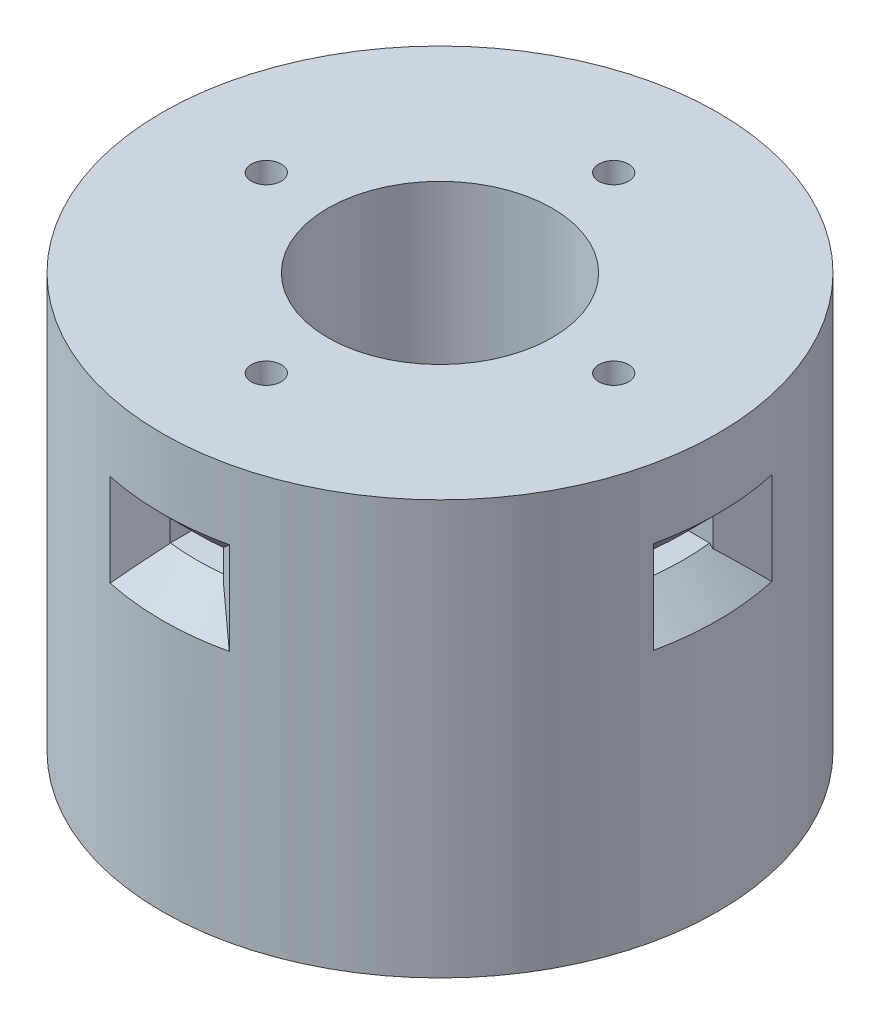
from build123d import *

# Parameters (mm, degrees)
BOSS_EXTRUDE1_DEPTH      = 10
BOSS_EXTRUDE1_DEPTH_BACK = 49.6
SKETCH1_R                = 40
CUT_EXTRUDE1_REACH       = 84.172
SKETCH2_R                = 16.15
SKETCH5_R                = 2.15
M4_HEAT_INSERT_DEPTH     = 25
SKETCH6_R                = 21.05
CUT_EXTRUDE2_DEPTH       = 16.5
CUT_EXTRUDE3_START       = -15
SKETCH7_R                = 2.15
CUT_EXTRUDE3_DEPTH       = 3.3
CIRPATTERN1_COUNT        = 4
CHAMFER1_SIZE            = 5
CHAMFER1_SIZE_2          = 4.562380824


with BuildPart() as part:
    # Sketch1 → Boss-Extrude1 (new, two sides: drawn at the far end of the back side and taken through both)
    with BuildSketch(Plane(origin=(0, 0, 0), x_dir=(1, 0, 0), z_dir=(0, 1, 0)).offset(-BOSS_EXTRUDE1_DEPTH_BACK)):
        with Locations(Location((0, 0, 0), (0, 0, 270))):
            Circle(SKETCH1_R)
    extrude(amount=BOSS_EXTRUDE1_DEPTH + BOSS_EXTRUDE1_DEPTH_BACK)

    # Sketch2 → Cut-Extrude1 (cut, up to next)
    with BuildSketch(Plane(origin=(0, 10, 0), x_dir=(1, 0, 0), z_dir=(0, 1, 0)), mode=Mode.PRIVATE) as cut_extrude1_sk1:
        with Locations(Location((0, 0, 0), (0, 0, 270))):
            Circle(SKETCH2_R)
    cut_extrude1_tool1 = extrude(cut_extrude1_sk1.sketch, amount=-CUT_EXTRUDE1_REACH, mode=Mode.PRIVATE) & part.part
    add(cut_extrude1_tool1.solids().sort_by_distance((0, 10, 0))[0], mode=Mode.SUBTRACT)

    # Sketch5 → m4 heat insert (cut)
    with BuildSketch(Plane(origin=(0, 10, 0), x_dir=(1, 0, 0), z_dir=(0, 1, 0))):
        with Locations(Location((0, 25, 0), (0, 0, 270))):
            Circle(SKETCH5_R)
        with Locations(Location((25, 0, 0), (0, 0, 270))):
            Circle(SKETCH5_R)
        with Locations(Location((0, -25, 0), (0, 0, 270))):
            Circle(SKETCH5_R)
        with Locations(Location((-25, 0, 0), (0, 0, 270))):
            Circle(SKETCH5_R)
    extrude(amount=-M4_HEAT_INSERT_DEPTH, mode=Mode.SUBTRACT)

    # Sketch6 → Cut-Extrude2 (cut)
    with BuildSketch(Plane(origin=(0, -49.6, 0), x_dir=(-1, 0, 0), z_dir=(0, -1, 0))):
        with Locations(Location((0, 0, 0), (0, 0, 90))):
            Circle(SKETCH6_R)
    extrude(amount=-CUT_EXTRUDE2_DEPTH, mode=Mode.SUBTRACT)

    # Sketch7 → Cut-Extrude3 (cut)
    # profile 1 of 2: a face of its own
    with BuildSketch(Plane(origin=(0, 10, 0), x_dir=(1, 0, 0), z_dir=(0, 1, 0)).offset(CUT_EXTRUDE3_START)):
        with BuildLine():
            Line((2.020725942, 28.5), (4.041451884, 25))
            Line((4.041451884, 25), (4.041451884, 39.795309606))
            ThreePointArc((4.041451884, 39.795309606), (0, 40), (-4.041451884, 39.795309606))
            Line((-4.041451884, 39.795309606), (-4.041451884, 25))
            Line((-4.041451884, 25), (-2.020725942, 28.5))
            Line((-2.020725942, 28.5), (2.020725942, 28.5))
        make_face()
    # profile 2 of 2: a face of its own
    with BuildSketch(Plane(origin=(0, 10, 0), x_dir=(1, 0, 0), z_dir=(0, 1, 0)).offset(CUT_EXTRUDE3_START)):
        Polygon((-2.020725942, 21.5), (2.020725942, 21.5), (4.041451884, 25), (2.020725942, 28.5), (-2.020725942, 28.5), (-4.041451884, 25), align=None)
        with Locations(Location((0, 25, 0), (0, 0, 270))):
            Circle(SKETCH7_R, mode=Mode.SUBTRACT)
    cut_extrude3 = extrude(amount=-CUT_EXTRUDE3_DEPTH, mode=Mode.SUBTRACT)

    # CirPattern1: Cut-Extrude3 ×4 about axis
    cirpattern1_axis = Axis((0, 0, 0), (0, 1, 0))
    for i in range(1, CIRPATTERN1_COUNT):
        add(cut_extrude3.rotate(cirpattern1_axis, i * 360 / CIRPATTERN1_COUNT), mode=Mode.SUBTRACT)

    # Chamfer1
    # the kernel refuses this chamfer: 5, 4.562380824 mm, written as the material it takes off along each edge
    with BuildSketch(Plane(origin=(0, -8.3, 0), x_dir=(0.4101983221335599, 0, -0.9119963467683477), z_dir=(0.9119963467683477, 0, 0.4101983221335599))) as chamfer1_piece_1_section:
        Polygon((40, -CHAMFER1_SIZE), (40 - CHAMFER1_SIZE, 0), (40, 0), align=None)
    chamfer1_piece_1 = revolve(axis=Axis((0, -8.3, 0), (0, 1, 0)), revolution_arc=48.434587391, mode=Mode.PRIVATE)
    chamfer1_piece_1 = split(chamfer1_piece_1, bisect_by=Plane(origin=(4.041451884, -8.3, 0), z_dir=(-1, 0, 0)), keep=Keep.TOP, mode=Mode.PRIVATE)
    chamfer1_piece_1 = split(chamfer1_piece_1, bisect_by=Plane(origin=(-4.041451884, -8.3, 0), z_dir=(1, 0, 0)), keep=Keep.TOP, mode=Mode.PRIVATE)
    add(chamfer1_piece_1, mode=Mode.SUBTRACT)
    with BuildSketch(Plane(origin=(0, -5, 0), x_dir=(0.4101983221335599, 0, -0.9119963467683477), z_dir=(0.9119963467683477, 0, 0.4101983221335599))) as chamfer1_piece_2_section:
        Polygon((40, CHAMFER1_SIZE), (40 - CHAMFER1_SIZE, 0), (40, 0), align=None)
    chamfer1_piece_2 = revolve(axis=Axis((0, -5, 0), (0, 1, 0)), revolution_arc=48.434587391, mode=Mode.PRIVATE)
    chamfer1_piece_2 = split(chamfer1_piece_2, bisect_by=Plane(origin=(-4.041451884, -5, 0), z_dir=(1, 0, 0)), keep=Keep.TOP, mode=Mode.PRIVATE)
    chamfer1_piece_2 = split(chamfer1_piece_2, bisect_by=Plane(origin=(4.041451884, -5, 0), z_dir=(-1, 0, 0)), keep=Keep.TOP, mode=Mode.PRIVATE)
    add(chamfer1_piece_2, mode=Mode.SUBTRACT)
    with BuildSketch(Plane(origin=(0, -8.3, 0), x_dir=(0.9119963467683476, 0, 0.4101983221335601), z_dir=(-0.4101983221335601, 0, 0.9119963467683476))) as chamfer1_piece_3_section:
        Polygon((40, -CHAMFER1_SIZE), (40 - CHAMFER1_SIZE, 0), (40, 0), align=None)
    chamfer1_piece_3 = revolve(axis=Axis((0, -8.3, 0), (0, 1, 0)), revolution_arc=48.434587391, mode=Mode.PRIVATE)
    chamfer1_piece_3 = split(chamfer1_piece_3, bisect_by=Plane(origin=(0, -8.3, 4.041451884), z_dir=(0, 0, -1)), keep=Keep.TOP, mode=Mode.PRIVATE)
    chamfer1_piece_3 = split(chamfer1_piece_3, bisect_by=Plane(origin=(0, -8.3, -4.041451884), z_dir=(0, 0, 1)), keep=Keep.TOP, mode=Mode.PRIVATE)
    add(chamfer1_piece_3, mode=Mode.SUBTRACT)
    with BuildSketch(Plane(origin=(0, -5, 0), x_dir=(0.9119963467683476, 0, 0.4101983221335601), z_dir=(-0.4101983221335601, 0, 0.9119963467683476))) as chamfer1_piece_4_section:
        Polygon((40, CHAMFER1_SIZE), (40 - CHAMFER1_SIZE, 0), (40, 0), align=None)
    chamfer1_piece_4 = revolve(axis=Axis((0, -5, 0), (0, 1, 0)), revolution_arc=48.434587391, mode=Mode.PRIVATE)
    chamfer1_piece_4 = split(chamfer1_piece_4, bisect_by=Plane(origin=(0, -5, 4.041451884), z_dir=(0, 0, -1)), keep=Keep.TOP, mode=Mode.PRIVATE)
    chamfer1_piece_4 = split(chamfer1_piece_4, bisect_by=Plane(origin=(0, -5, -4.041451884), z_dir=(0, 0, 1)), keep=Keep.TOP, mode=Mode.PRIVATE)
    add(chamfer1_piece_4, mode=Mode.SUBTRACT)
    with BuildSketch(Plane(origin=(0, -8.3, 0), x_dir=(0, 0, 1), z_dir=(-1, 0, 0))) as chamfer1_piece_5_section:
        Polygon((40, -CHAMFER1_SIZE), (40 - CHAMFER1_SIZE, 0), (40, 0), align=None)
    chamfer1_piece_5 = revolve(axis=Axis((0, -8.3, 0), (0, 1, 0)), revolution_arc=24.217201574, mode=Mode.PRIVATE)
    chamfer1_piece_5 = split(chamfer1_piece_5, bisect_by=Plane(origin=(4.041451884, -8.3, 0), z_dir=(-1, 0, 0)), keep=Keep.TOP, mode=Mode.PRIVATE)
    add(chamfer1_piece_5, mode=Mode.SUBTRACT)
    with BuildSketch(Plane(origin=(0, -5, 0), x_dir=(0, 0, 1), z_dir=(-1, 0, 0))) as chamfer1_piece_6_section:
        Polygon((40, CHAMFER1_SIZE), (40 - CHAMFER1_SIZE, 0), (40, 0), align=None)
    chamfer1_piece_6 = revolve(axis=Axis((0, -5, 0), (0, 1, 0)), revolution_arc=24.217201574, mode=Mode.PRIVATE)
    chamfer1_piece_6 = split(chamfer1_piece_6, bisect_by=Plane(origin=(4.041451884, -5, 0), z_dir=(-1, 0, 0)), keep=Keep.TOP, mode=Mode.PRIVATE)
    add(chamfer1_piece_6, mode=Mode.SUBTRACT)
    with BuildSketch(Plane(origin=(0, -8.3, 0), x_dir=(-0.9119963467683476, 0, -0.41019832213355983), z_dir=(0.41019832213355983, 0, -0.9119963467683476))) as chamfer1_piece_7_section:
        Polygon((40, -CHAMFER1_SIZE), (40 - CHAMFER1_SIZE, 0), (40, 0), align=None)
    chamfer1_piece_7 = revolve(axis=Axis((0, -8.3, 0), (0, 1, 0)), revolution_arc=48.434587391, mode=Mode.PRIVATE)
    chamfer1_piece_7 = split(chamfer1_piece_7, bisect_by=Plane(origin=(0, -8.3, -4.041451884), z_dir=(0, 0, 1)), keep=Keep.TOP, mode=Mode.PRIVATE)
    chamfer1_piece_7 = split(chamfer1_piece_7, bisect_by=Plane(origin=(0, -8.3, 4.041451884), z_dir=(0, 0, -1)), keep=Keep.TOP, mode=Mode.PRIVATE)
    add(chamfer1_piece_7, mode=Mode.SUBTRACT)
    with BuildSketch(Plane(origin=(0, -5, 0), x_dir=(-0.9119963467683476, 0, -0.41019832213355983), z_dir=(0.41019832213355983, 0, -0.9119963467683476))) as chamfer1_piece_8_section:
        Polygon((40, CHAMFER1_SIZE), (40 - CHAMFER1_SIZE, 0), (40, 0), align=None)
    chamfer1_piece_8 = revolve(axis=Axis((0, -5, 0), (0, 1, 0)), revolution_arc=48.434587391, mode=Mode.PRIVATE)
    chamfer1_piece_8 = split(chamfer1_piece_8, bisect_by=Plane(origin=(0, -5, 4.041451884), z_dir=(0, 0, -1)), keep=Keep.TOP, mode=Mode.PRIVATE)
    chamfer1_piece_8 = split(chamfer1_piece_8, bisect_by=Plane(origin=(0, -5, -4.041451884), z_dir=(0, 0, 1)), keep=Keep.TOP, mode=Mode.PRIVATE)
    add(chamfer1_piece_8, mode=Mode.SUBTRACT)
    with BuildSketch(Plane(origin=(-4.041451884, -5, -39.795309606), x_dir=(-0.9871709990890453, 0, 0.1596665856011717), z_dir=(0, -1, 0)), Plane(origin=(39.795309606, -5, -4.041451884), x_dir=(-0.15966658560117158, 0, -0.9871709990890453), z_dir=(0, -1, 0)), Plane(origin=(4.041451884, -5, 39.795309606), x_dir=(0.9871709990890453, 0, -0.1596665856011715), z_dir=(0, -1, 0)), Plane(origin=(-39.795309606, -5, 4.041451884), x_dir=(0.15966658560117108, 0, 0.9871709990890454), z_dir=(0, -1, 0))) as chamfer1_piece_9:
        with BuildLine():
            Line((4.728754227, 0), (CHAMFER1_SIZE_2 * 0.159666585592, -CHAMFER1_SIZE_2 * 0.987170999033))
            Line((CHAMFER1_SIZE_2 * 0.159666585592, -CHAMFER1_SIZE_2 * 0.987170999033), (0, 0))
            ThreePointArc((0, 0), (2.430776382, 0.069884523), (4.728754227, 0))
        make_face()
    extrude(amount=3.3, mode=Mode.SUBTRACT)
    with BuildSketch(Plane(origin=(4.041451884, -5, -39.795309606), x_dir=(0.9878706701708511, 0, 0.15527890718379386), z_dir=(0, -1, 0)), Plane(origin=(39.795309606, -5, 4.041451884), x_dir=(-0.15527890718379558, 0, 0.9878706701708508), z_dir=(0, -1, 0)), Plane(origin=(-4.041451884, -5, 39.795309606), x_dir=(-0.9878706701708511, 0, -0.15527890718379447), z_dir=(0, -1, 0)), Plane(origin=(-39.795309606, -5, -4.041451884), x_dir=(0.15527890718379458, 0, -0.9878706701708511), z_dir=(0, -1, 0))) as chamfer1_piece_10:
        with BuildLine():
            Line((4.373880811, 0), (CHAMFER1_SIZE * 0.155278907184, CHAMFER1_SIZE * 0.987870670171))
            Line((CHAMFER1_SIZE * 0.155278907184, CHAMFER1_SIZE * 0.987870670171), (0, 0))
            ThreePointArc((0, 0), (2.245782571, -0.059785317), (4.373880811, 0))
        make_face()
    extrude(amount=3.3, mode=Mode.SUBTRACT)
    with BuildSketch(Plane(origin=(0, -5, 0), x_dir=(-0.41019685580431725, 0, 0.9119970062934702), z_dir=(-0.9119970062934702, 0, -0.41019685580431725))) as chamfer1_piece_11_section:
        Polygon((40, CHAMFER1_SIZE), (40 - CHAMFER1_SIZE, 0), (40, 0), align=None)
    chamfer1_piece_11 = revolve(axis=Axis((0, -5, 0), (0, 1, 0)), revolution_arc=24.217201574, mode=Mode.PRIVATE)
    chamfer1_piece_11 = split(chamfer1_piece_11, bisect_by=Plane(origin=(-4.041451884, -5, 0), z_dir=(1, 0, 0)), keep=Keep.TOP, mode=Mode.PRIVATE)
    add(chamfer1_piece_11, mode=Mode.SUBTRACT)
    with BuildSketch(Plane(origin=(0, -8.3, 0), x_dir=(-0.41019685580431725, 0, 0.9119970062934702), z_dir=(-0.9119970062934702, 0, -0.41019685580431725))) as chamfer1_piece_12_section:
        Polygon((40, -CHAMFER1_SIZE), (40 - CHAMFER1_SIZE, 0), (40, 0), align=None)
    chamfer1_piece_12 = revolve(axis=Axis((0, -8.3, 0), (0, 1, 0)), revolution_arc=24.217201574, mode=Mode.PRIVATE)
    chamfer1_piece_12 = split(chamfer1_piece_12, bisect_by=Plane(origin=(-4.041451884, -8.3, 0), z_dir=(1, 0, 0)), keep=Keep.TOP, mode=Mode.PRIVATE)
    add(chamfer1_piece_12, mode=Mode.SUBTRACT)
    with BuildSketch(Plane(origin=(4.041451884, -5, -39.795309606), x_dir=(0.9878706701708511, 0, 0.15527890718379386), z_dir=(0, -1, 0))) as chamfer1_piece_13a_section:
        with BuildLine():
            Line((4.373880811, 0), (CHAMFER1_SIZE * 0.155278907184, CHAMFER1_SIZE * 0.987870670171))
            Line((CHAMFER1_SIZE * 0.155278907184, CHAMFER1_SIZE * 0.987870670171), (0, 0))
            ThreePointArc((0, 0), (2.245782571, -0.059785317), (4.373880811, 0))
        make_face()
    chamfer1_piece_13a = extrude(amount=16.15841494, mode=Mode.PRIVATE)
    chamfer1_piece_13a = split(chamfer1_piece_13a, bisect_by=Plane(origin=(4.041451884, -8.3, -39.795309606), z_dir=(0, -1, 0)), keep=Keep.TOP, mode=Mode.PRIVATE)
    with BuildSketch(Plane(origin=(0, -8.3, 0), x_dir=(0.4101983221335599, 0, -0.9119963467683477), z_dir=(0.9119963467683477, 0, 0.4101983221335599))) as chamfer1_piece_13b_section:
        Polygon((40, -CHAMFER1_SIZE), (40 - CHAMFER1_SIZE, 0), (40, 0), align=None)
    chamfer1_piece_13b = revolve(axis=Axis((0, -8.3, 0), (0, 1, 0)), revolution_arc=48.434587391, mode=Mode.PRIVATE)
    chamfer1_piece_13b = split(chamfer1_piece_13b, bisect_by=Plane(origin=(4.041451884, -8.3, 0), z_dir=(1, 0, 0)), keep=Keep.TOP, mode=Mode.PRIVATE)
    chamfer1_piece_13 = chamfer1_piece_13a & chamfer1_piece_13b
    add(chamfer1_piece_13, mode=Mode.SUBTRACT)
    with BuildSketch(Plane(origin=(-4.041451884, -5, -39.795309606), x_dir=(-0.9871709990890453, 0, 0.1596665856011717), z_dir=(0, -1, 0))) as chamfer1_piece_14a_section:
        with BuildLine():
            Line((4.728754227, 0), (CHAMFER1_SIZE_2 * 0.159666585592, -CHAMFER1_SIZE_2 * 0.987170999033))
            Line((CHAMFER1_SIZE_2 * 0.159666585592, -CHAMFER1_SIZE_2 * 0.987170999033), (0, 0))
            ThreePointArc((0, 0), (2.430776382, 0.069884523), (4.728754227, 0))
        make_face()
    chamfer1_piece_14a = extrude(amount=15.45967031, mode=Mode.PRIVATE)
    chamfer1_piece_14a = split(chamfer1_piece_14a, bisect_by=Plane(origin=(-4.041451884, -8.3, -39.795309606), z_dir=(0, -1, 0)), keep=Keep.TOP, mode=Mode.PRIVATE)
    with BuildSketch(Plane(origin=(0, -8.3, 0), x_dir=(0.4101983221335599, 0, -0.9119963467683477), z_dir=(0.9119963467683477, 0, 0.4101983221335599))) as chamfer1_piece_14b_section:
        Polygon((40, -CHAMFER1_SIZE), (40 - CHAMFER1_SIZE, 0), (40, 0), align=None)
    chamfer1_piece_14b = revolve(axis=Axis((0, -8.3, 0), (0, 1, 0)), revolution_arc=48.434587391, mode=Mode.PRIVATE)
    chamfer1_piece_14b = split(chamfer1_piece_14b, bisect_by=Plane(origin=(-4.041451884, -8.3, 0), z_dir=(-1, 0, 0)), keep=Keep.TOP, mode=Mode.PRIVATE)
    chamfer1_piece_14 = chamfer1_piece_14a & chamfer1_piece_14b
    add(chamfer1_piece_14, mode=Mode.SUBTRACT)
    with BuildSketch(Plane(origin=(0, -5, 0), x_dir=(0.4101983221335599, 0, -0.9119963467683477), z_dir=(0.9119963467683477, 0, 0.4101983221335599))) as chamfer1_piece_15a_section:
        Polygon((40, CHAMFER1_SIZE), (40 - CHAMFER1_SIZE, 0), (40, 0), align=None)
    chamfer1_piece_15a = revolve(axis=Axis((0, -5, 0), (0, 1, 0)), revolution_arc=48.434587391, mode=Mode.PRIVATE)
    chamfer1_piece_15a = split(chamfer1_piece_15a, bisect_by=Plane(origin=(4.041451884, -5, 0), z_dir=(1, 0, 0)), keep=Keep.TOP, mode=Mode.PRIVATE)
    with BuildSketch(Plane(origin=(4.041451884, 7.85841494, -39.795309606), x_dir=(0.9878706701708511, 0, 0.15527890718379386), z_dir=(0, -1, 0))) as chamfer1_piece_15b_section:
        with BuildLine():
            Line((4.373880811, 0), (CHAMFER1_SIZE * 0.155278907184, CHAMFER1_SIZE * 0.987870670171))
            Line((CHAMFER1_SIZE * 0.155278907184, CHAMFER1_SIZE * 0.987870670171), (0, 0))
            ThreePointArc((0, 0), (2.245782571, -0.059785317), (4.373880811, 0))
        make_face()
    chamfer1_piece_15b = extrude(amount=16.15841494, mode=Mode.PRIVATE)
    chamfer1_piece_15b = split(chamfer1_piece_15b, bisect_by=Plane(origin=(4.041451884, -5, -39.795309606), z_dir=(0, 1, 0)), keep=Keep.TOP, mode=Mode.PRIVATE)
    chamfer1_piece_15 = chamfer1_piece_15a & chamfer1_piece_15b
    add(chamfer1_piece_15, mode=Mode.SUBTRACT)
    with BuildSketch(Plane(origin=(0, -5, 0), x_dir=(0.4101983221335599, 0, -0.9119963467683477), z_dir=(0.9119963467683477, 0, 0.4101983221335599))) as chamfer1_piece_16a_section:
        Polygon((40, CHAMFER1_SIZE), (40 - CHAMFER1_SIZE, 0), (40, 0), align=None)
    chamfer1_piece_16a = revolve(axis=Axis((0, -5, 0), (0, 1, 0)), revolution_arc=48.434587391, mode=Mode.PRIVATE)
    chamfer1_piece_16a = split(chamfer1_piece_16a, bisect_by=Plane(origin=(-4.041451884, -5, 0), z_dir=(-1, 0, 0)), keep=Keep.TOP, mode=Mode.PRIVATE)
    with BuildSketch(Plane(origin=(-4.041451884, 7.15967031, -39.795309606), x_dir=(-0.9871709990890453, 0, 0.1596665856011717), z_dir=(0, -1, 0))) as chamfer1_piece_16b_section:
        with BuildLine():
            Line((4.728754227, 0), (CHAMFER1_SIZE_2 * 0.159666585592, -CHAMFER1_SIZE_2 * 0.987170999033))
            Line((CHAMFER1_SIZE_2 * 0.159666585592, -CHAMFER1_SIZE_2 * 0.987170999033), (0, 0))
            ThreePointArc((0, 0), (2.430776382, 0.069884523), (4.728754227, 0))
        make_face()
    chamfer1_piece_16b = extrude(amount=15.45967031, mode=Mode.PRIVATE)
    chamfer1_piece_16b = split(chamfer1_piece_16b, bisect_by=Plane(origin=(-4.041451884, -5, -39.795309606), z_dir=(0, 1, 0)), keep=Keep.TOP, mode=Mode.PRIVATE)
    chamfer1_piece_16 = chamfer1_piece_16a & chamfer1_piece_16b
    add(chamfer1_piece_16, mode=Mode.SUBTRACT)
    with BuildSketch(Plane(origin=(0, -8.3, 0), x_dir=(0.9119963467683476, 0, 0.4101983221335601), z_dir=(-0.4101983221335601, 0, 0.9119963467683476))) as chamfer1_piece_17a_section:
        Polygon((40, -CHAMFER1_SIZE), (40 - CHAMFER1_SIZE, 0), (40, 0), align=None)
    chamfer1_piece_17a = revolve(axis=Axis((0, -8.3, 0), (0, 1, 0)), revolution_arc=48.434587391, mode=Mode.PRIVATE)
    chamfer1_piece_17a = split(chamfer1_piece_17a, bisect_by=Plane(origin=(0, -8.3, 4.041451884), z_dir=(0, 0, 1)), keep=Keep.TOP, mode=Mode.PRIVATE)
    with BuildSketch(Plane(origin=(39.795309606, -5, 4.041451884), x_dir=(-0.15527890718379558, 0, 0.9878706701708508), z_dir=(0, -1, 0))) as chamfer1_piece_17b_section:
        with BuildLine():
            Line((4.373880811, 0), (CHAMFER1_SIZE * 0.155278907184, CHAMFER1_SIZE * 0.987870670171))
            Line((CHAMFER1_SIZE * 0.155278907184, CHAMFER1_SIZE * 0.987870670171), (0, 0))
            ThreePointArc((0, 0), (2.245782571, -0.059785317), (4.373880811, 0))
        make_face()
    chamfer1_piece_17b = extrude(amount=16.15841494, mode=Mode.PRIVATE)
    chamfer1_piece_17b = split(chamfer1_piece_17b, bisect_by=Plane(origin=(39.795309606, -8.3, 4.041451884), z_dir=(0, -1, 0)), keep=Keep.TOP, mode=Mode.PRIVATE)
    chamfer1_piece_17 = chamfer1_piece_17a & chamfer1_piece_17b
    add(chamfer1_piece_17, mode=Mode.SUBTRACT)
    with BuildSketch(Plane(origin=(39.795309606, -5, -4.041451884), x_dir=(-0.15966658560117158, 0, -0.9871709990890453), z_dir=(0, -1, 0))) as chamfer1_piece_18a_section:
        with BuildLine():
            Line((4.728754227, 0), (CHAMFER1_SIZE_2 * 0.159666585592, -CHAMFER1_SIZE_2 * 0.987170999033))
            Line((CHAMFER1_SIZE_2 * 0.159666585592, -CHAMFER1_SIZE_2 * 0.987170999033), (0, 0))
            ThreePointArc((0, 0), (2.430776382, 0.069884523), (4.728754227, 0))
        make_face()
    chamfer1_piece_18a = extrude(amount=15.45967031, mode=Mode.PRIVATE)
    chamfer1_piece_18a = split(chamfer1_piece_18a, bisect_by=Plane(origin=(39.795309606, -8.3, -4.041451884), z_dir=(0, -1, 0)), keep=Keep.TOP, mode=Mode.PRIVATE)
    with BuildSketch(Plane(origin=(0, -8.3, 0), x_dir=(0.9119963467683476, 0, 0.4101983221335601), z_dir=(-0.4101983221335601, 0, 0.9119963467683476))) as chamfer1_piece_18b_section:
        Polygon((40, -CHAMFER1_SIZE), (40 - CHAMFER1_SIZE, 0), (40, 0), align=None)
    chamfer1_piece_18b = revolve(axis=Axis((0, -8.3, 0), (0, 1, 0)), revolution_arc=48.434587391, mode=Mode.PRIVATE)
    chamfer1_piece_18b = split(chamfer1_piece_18b, bisect_by=Plane(origin=(0, -8.3, -4.041451884), z_dir=(0, 0, -1)), keep=Keep.TOP, mode=Mode.PRIVATE)
    chamfer1_piece_18 = chamfer1_piece_18a & chamfer1_piece_18b
    add(chamfer1_piece_18, mode=Mode.SUBTRACT)
    with BuildSketch(Plane(origin=(0, -5, 0), x_dir=(0.9119963467683476, 0, 0.4101983221335601), z_dir=(-0.4101983221335601, 0, 0.9119963467683476))) as chamfer1_piece_19a_section:
        Polygon((40, CHAMFER1_SIZE), (40 - CHAMFER1_SIZE, 0), (40, 0), align=None)
    chamfer1_piece_19a = revolve(axis=Axis((0, -5, 0), (0, 1, 0)), revolution_arc=48.434587391, mode=Mode.PRIVATE)
    chamfer1_piece_19a = split(chamfer1_piece_19a, bisect_by=Plane(origin=(0, -5, 4.041451884), z_dir=(0, 0, 1)), keep=Keep.TOP, mode=Mode.PRIVATE)
    with BuildSketch(Plane(origin=(39.795309606, 7.85841494, 4.041451884), x_dir=(-0.15527890718379558, 0, 0.9878706701708508), z_dir=(0, -1, 0))) as chamfer1_piece_19b_section:
        with BuildLine():
            Line((4.373880811, 0), (CHAMFER1_SIZE * 0.155278907184, CHAMFER1_SIZE * 0.987870670171))
            Line((CHAMFER1_SIZE * 0.155278907184, CHAMFER1_SIZE * 0.987870670171), (0, 0))
            ThreePointArc((0, 0), (2.245782571, -0.059785317), (4.373880811, 0))
        make_face()
    chamfer1_piece_19b = extrude(amount=16.15841494, mode=Mode.PRIVATE)
    chamfer1_piece_19b = split(chamfer1_piece_19b, bisect_by=Plane(origin=(39.795309606, -5, 4.041451884), z_dir=(0, 1, 0)), keep=Keep.TOP, mode=Mode.PRIVATE)
    chamfer1_piece_19 = chamfer1_piece_19a & chamfer1_piece_19b
    add(chamfer1_piece_19, mode=Mode.SUBTRACT)
    with BuildSketch(Plane(origin=(0, -5, 0), x_dir=(0.9119963467683476, 0, 0.4101983221335601), z_dir=(-0.4101983221335601, 0, 0.9119963467683476))) as chamfer1_piece_20a_section:
        Polygon((40, CHAMFER1_SIZE), (40 - CHAMFER1_SIZE, 0), (40, 0), align=None)
    chamfer1_piece_20a = revolve(axis=Axis((0, -5, 0), (0, 1, 0)), revolution_arc=48.434587391, mode=Mode.PRIVATE)
    chamfer1_piece_20a = split(chamfer1_piece_20a, bisect_by=Plane(origin=(0, -5, -4.041451884), z_dir=(0, 0, -1)), keep=Keep.TOP, mode=Mode.PRIVATE)
    with BuildSketch(Plane(origin=(39.795309606, 7.15967031, -4.041451884), x_dir=(-0.15966658560117158, 0, -0.9871709990890453), z_dir=(0, -1, 0))) as chamfer1_piece_20b_section:
        with BuildLine():
            Line((4.728754227, 0), (CHAMFER1_SIZE_2 * 0.159666585592, -CHAMFER1_SIZE_2 * 0.987170999033))
            Line((CHAMFER1_SIZE_2 * 0.159666585592, -CHAMFER1_SIZE_2 * 0.987170999033), (0, 0))
            ThreePointArc((0, 0), (2.430776382, 0.069884523), (4.728754227, 0))
        make_face()
    chamfer1_piece_20b = extrude(amount=15.45967031, mode=Mode.PRIVATE)
    chamfer1_piece_20b = split(chamfer1_piece_20b, bisect_by=Plane(origin=(39.795309606, -5, -4.041451884), z_dir=(0, 1, 0)), keep=Keep.TOP, mode=Mode.PRIVATE)
    chamfer1_piece_20 = chamfer1_piece_20a & chamfer1_piece_20b
    add(chamfer1_piece_20, mode=Mode.SUBTRACT)
    with BuildSketch(Plane(origin=(4.041451884, -5, 39.795309606), x_dir=(0.9871709990890453, 0, -0.1596665856011715), z_dir=(0, -1, 0))) as chamfer1_piece_21a_section:
        with BuildLine():
            Line((4.728754227, 0), (CHAMFER1_SIZE_2 * 0.159666585592, -CHAMFER1_SIZE_2 * 0.987170999033))
            Line((CHAMFER1_SIZE_2 * 0.159666585592, -CHAMFER1_SIZE_2 * 0.987170999033), (0, 0))
            ThreePointArc((0, 0), (2.430776382, 0.069884523), (4.728754227, 0))
        make_face()
    chamfer1_piece_21a = extrude(amount=15.45967031, mode=Mode.PRIVATE)
    chamfer1_piece_21a = split(chamfer1_piece_21a, bisect_by=Plane(origin=(4.041451884, -8.3, 39.795309606), z_dir=(0, -1, 0)), keep=Keep.TOP, mode=Mode.PRIVATE)
    with BuildSketch(Plane(origin=(0, -8.3, 0), x_dir=(0, 0, 1), z_dir=(-1, 0, 0))) as chamfer1_piece_21b_section:
        Polygon((40, -CHAMFER1_SIZE), (40 - CHAMFER1_SIZE, 0), (40, 0), align=None)
    chamfer1_piece_21b = revolve(axis=Axis((0, -8.3, 0), (0, 1, 0)), revolution_arc=24.217201574, mode=Mode.PRIVATE)
    chamfer1_piece_21b = split(chamfer1_piece_21b, bisect_by=Plane(origin=(4.041451884, -8.3, 0), z_dir=(1, 0, 0)), keep=Keep.TOP, mode=Mode.PRIVATE)
    chamfer1_piece_21 = chamfer1_piece_21a & chamfer1_piece_21b
    add(chamfer1_piece_21, mode=Mode.SUBTRACT)
    with BuildSketch(Plane(origin=(0, -5, 0), x_dir=(0, 0, 1), z_dir=(-1, 0, 0))) as chamfer1_piece_22a_section:
        Polygon((40, CHAMFER1_SIZE), (40 - CHAMFER1_SIZE, 0), (40, 0), align=None)
    chamfer1_piece_22a = revolve(axis=Axis((0, -5, 0), (0, 1, 0)), revolution_arc=24.217201574, mode=Mode.PRIVATE)
    chamfer1_piece_22a = split(chamfer1_piece_22a, bisect_by=Plane(origin=(4.041451884, -5, 0), z_dir=(1, 0, 0)), keep=Keep.TOP, mode=Mode.PRIVATE)
    with BuildSketch(Plane(origin=(4.041451884, 7.15967031, 39.795309606), x_dir=(0.9871709990890453, 0, -0.1596665856011715), z_dir=(0, -1, 0))) as chamfer1_piece_22b_section:
        with BuildLine():
            Line((4.728754227, 0), (CHAMFER1_SIZE_2 * 0.159666585592, -CHAMFER1_SIZE_2 * 0.987170999033))
            Line((CHAMFER1_SIZE_2 * 0.159666585592, -CHAMFER1_SIZE_2 * 0.987170999033), (0, 0))
            ThreePointArc((0, 0), (2.430776382, 0.069884523), (4.728754227, 0))
        make_face()
    chamfer1_piece_22b = extrude(amount=15.45967031, mode=Mode.PRIVATE)
    chamfer1_piece_22b = split(chamfer1_piece_22b, bisect_by=Plane(origin=(4.041451884, -5, 39.795309606), z_dir=(0, 1, 0)), keep=Keep.TOP, mode=Mode.PRIVATE)
    chamfer1_piece_22 = chamfer1_piece_22a & chamfer1_piece_22b
    add(chamfer1_piece_22, mode=Mode.SUBTRACT)
    with BuildSketch(Plane(origin=(-39.795309606, -5, -4.041451884), x_dir=(0.15527890718379458, 0, -0.9878706701708511), z_dir=(0, -1, 0))) as chamfer1_piece_23a_section:
        with BuildLine():
            Line((4.373880811, 0), (CHAMFER1_SIZE * 0.155278907184, CHAMFER1_SIZE * 0.987870670171))
            Line((CHAMFER1_SIZE * 0.155278907184, CHAMFER1_SIZE * 0.987870670171), (0, 0))
            ThreePointArc((0, 0), (2.245782571, -0.059785317), (4.373880811, 0))
        make_face()
    chamfer1_piece_23a = extrude(amount=16.15841494, mode=Mode.PRIVATE)
    chamfer1_piece_23a = split(chamfer1_piece_23a, bisect_by=Plane(origin=(-39.795309606, -8.3, -4.041451884), z_dir=(0, -1, 0)), keep=Keep.TOP, mode=Mode.PRIVATE)
    with BuildSketch(Plane(origin=(0, -8.3, 0), x_dir=(-0.9119963467683476, 0, -0.41019832213355983), z_dir=(0.41019832213355983, 0, -0.9119963467683476))) as chamfer1_piece_23b_section:
        Polygon((40, -CHAMFER1_SIZE), (40 - CHAMFER1_SIZE, 0), (40, 0), align=None)
    chamfer1_piece_23b = revolve(axis=Axis((0, -8.3, 0), (0, 1, 0)), revolution_arc=48.434587391, mode=Mode.PRIVATE)
    chamfer1_piece_23b = split(chamfer1_piece_23b, bisect_by=Plane(origin=(0, -8.3, -4.041451884), z_dir=(0, 0, -1)), keep=Keep.TOP, mode=Mode.PRIVATE)
    chamfer1_piece_23 = chamfer1_piece_23a & chamfer1_piece_23b
    add(chamfer1_piece_23, mode=Mode.SUBTRACT)
    with BuildSketch(Plane(origin=(-39.795309606, -5, 4.041451884), x_dir=(0.15966658560117108, 0, 0.9871709990890454), z_dir=(0, -1, 0))) as chamfer1_piece_24a_section:
        with BuildLine():
            Line((4.728754227, 0), (CHAMFER1_SIZE_2 * 0.159666585592, -CHAMFER1_SIZE_2 * 0.987170999033))
            Line((CHAMFER1_SIZE_2 * 0.159666585592, -CHAMFER1_SIZE_2 * 0.987170999033), (0, 0))
            ThreePointArc((0, 0), (2.430776382, 0.069884523), (4.728754227, 0))
        make_face()
    chamfer1_piece_24a = extrude(amount=15.45967031, mode=Mode.PRIVATE)
    chamfer1_piece_24a = split(chamfer1_piece_24a, bisect_by=Plane(origin=(-39.795309606, -8.3, 4.041451884), z_dir=(0, -1, 0)), keep=Keep.TOP, mode=Mode.PRIVATE)
    with BuildSketch(Plane(origin=(0, -8.3, 0), x_dir=(-0.9119963467683476, 0, -0.41019832213355983), z_dir=(0.41019832213355983, 0, -0.9119963467683476))) as chamfer1_piece_24b_section:
        Polygon((40, -CHAMFER1_SIZE), (40 - CHAMFER1_SIZE, 0), (40, 0), align=None)
    chamfer1_piece_24b = revolve(axis=Axis((0, -8.3, 0), (0, 1, 0)), revolution_arc=48.434587391, mode=Mode.PRIVATE)
    chamfer1_piece_24b = split(chamfer1_piece_24b, bisect_by=Plane(origin=(0, -8.3, 4.041451884), z_dir=(0, 0, 1)), keep=Keep.TOP, mode=Mode.PRIVATE)
    chamfer1_piece_24 = chamfer1_piece_24a & chamfer1_piece_24b
    add(chamfer1_piece_24, mode=Mode.SUBTRACT)
    with BuildSketch(Plane(origin=(0, -5, 0), x_dir=(-0.9119963467683476, 0, -0.41019832213355983), z_dir=(0.41019832213355983, 0, -0.9119963467683476))) as chamfer1_piece_25a_section:
        Polygon((40, CHAMFER1_SIZE), (40 - CHAMFER1_SIZE, 0), (40, 0), align=None)
    chamfer1_piece_25a = revolve(axis=Axis((0, -5, 0), (0, 1, 0)), revolution_arc=48.434587391, mode=Mode.PRIVATE)
    chamfer1_piece_25a = split(chamfer1_piece_25a, bisect_by=Plane(origin=(0, -5, -4.041451884), z_dir=(0, 0, -1)), keep=Keep.TOP, mode=Mode.PRIVATE)
    with BuildSketch(Plane(origin=(-39.795309606, 7.85841494, -4.041451884), x_dir=(0.15527890718379458, 0, -0.9878706701708511), z_dir=(0, -1, 0))) as chamfer1_piece_25b_section:
        with BuildLine():
            Line((4.373880811, 0), (CHAMFER1_SIZE * 0.155278907184, CHAMFER1_SIZE * 0.987870670171))
            Line((CHAMFER1_SIZE * 0.155278907184, CHAMFER1_SIZE * 0.987870670171), (0, 0))
            ThreePointArc((0, 0), (2.245782571, -0.059785317), (4.373880811, 0))
        make_face()
    chamfer1_piece_25b = extrude(amount=16.15841494, mode=Mode.PRIVATE)
    chamfer1_piece_25b = split(chamfer1_piece_25b, bisect_by=Plane(origin=(-39.795309606, -5, -4.041451884), z_dir=(0, 1, 0)), keep=Keep.TOP, mode=Mode.PRIVATE)
    chamfer1_piece_25 = chamfer1_piece_25a & chamfer1_piece_25b
    add(chamfer1_piece_25, mode=Mode.SUBTRACT)
    with BuildSketch(Plane(origin=(0, -5, 0), x_dir=(-0.9119963467683476, 0, -0.41019832213355983), z_dir=(0.41019832213355983, 0, -0.9119963467683476))) as chamfer1_piece_26a_section:
        Polygon((40, CHAMFER1_SIZE), (40 - CHAMFER1_SIZE, 0), (40, 0), align=None)
    chamfer1_piece_26a = revolve(axis=Axis((0, -5, 0), (0, 1, 0)), revolution_arc=48.434587391, mode=Mode.PRIVATE)
    chamfer1_piece_26a = split(chamfer1_piece_26a, bisect_by=Plane(origin=(0, -5, 4.041451884), z_dir=(0, 0, 1)), keep=Keep.TOP, mode=Mode.PRIVATE)
    with BuildSketch(Plane(origin=(-39.795309606, 7.15967031, 4.041451884), x_dir=(0.15966658560117108, 0, 0.9871709990890454), z_dir=(0, -1, 0))) as chamfer1_piece_26b_section:
        with BuildLine():
            Line((4.728754227, 0), (CHAMFER1_SIZE_2 * 0.159666585592, -CHAMFER1_SIZE_2 * 0.987170999033))
            Line((CHAMFER1_SIZE_2 * 0.159666585592, -CHAMFER1_SIZE_2 * 0.987170999033), (0, 0))
            ThreePointArc((0, 0), (2.430776382, 0.069884523), (4.728754227, 0))
        make_face()
    chamfer1_piece_26b = extrude(amount=15.45967031, mode=Mode.PRIVATE)
    chamfer1_piece_26b = split(chamfer1_piece_26b, bisect_by=Plane(origin=(-39.795309606, -5, 4.041451884), z_dir=(0, 1, 0)), keep=Keep.TOP, mode=Mode.PRIVATE)
    chamfer1_piece_26 = chamfer1_piece_26a & chamfer1_piece_26b
    add(chamfer1_piece_26, mode=Mode.SUBTRACT)
    with BuildSketch(Plane(origin=(-4.041451884, 7.85841494, 39.795309606), x_dir=(-0.9878706701708511, 0, -0.15527890718379447), z_dir=(0, -1, 0))) as chamfer1_piece_27a_section:
        with BuildLine():
            Line((4.373880811, 0), (CHAMFER1_SIZE * 0.155278907184, CHAMFER1_SIZE * 0.987870670171))
            Line((CHAMFER1_SIZE * 0.155278907184, CHAMFER1_SIZE * 0.987870670171), (0, 0))
            ThreePointArc((0, 0), (2.245782571, -0.059785317), (4.373880811, 0))
        make_face()
    chamfer1_piece_27a = extrude(amount=16.15841494, mode=Mode.PRIVATE)
    chamfer1_piece_27a = split(chamfer1_piece_27a, bisect_by=Plane(origin=(-4.041451884, -5, 39.795309606), z_dir=(0, 1, 0)), keep=Keep.TOP, mode=Mode.PRIVATE)
    with BuildSketch(Plane(origin=(0, -5, 0), x_dir=(-0.41019685580431725, 0, 0.9119970062934702), z_dir=(-0.9119970062934702, 0, -0.41019685580431725))) as chamfer1_piece_27b_section:
        Polygon((40, CHAMFER1_SIZE), (40 - CHAMFER1_SIZE, 0), (40, 0), align=None)
    chamfer1_piece_27b = revolve(axis=Axis((0, -5, 0), (0, 1, 0)), revolution_arc=24.217201574, mode=Mode.PRIVATE)
    chamfer1_piece_27b = split(chamfer1_piece_27b, bisect_by=Plane(origin=(-4.041451884, -5, 0), z_dir=(-1, 0, 0)), keep=Keep.TOP, mode=Mode.PRIVATE)
    chamfer1_piece_27 = chamfer1_piece_27a & chamfer1_piece_27b
    add(chamfer1_piece_27, mode=Mode.SUBTRACT)
    with BuildSketch(Plane(origin=(0, -8.3, 0), x_dir=(-0.41019685580431725, 0, 0.9119970062934702), z_dir=(-0.9119970062934702, 0, -0.41019685580431725))) as chamfer1_piece_28a_section:
        Polygon((40, -CHAMFER1_SIZE), (40 - CHAMFER1_SIZE, 0), (40, 0), align=None)
    chamfer1_piece_28a = revolve(axis=Axis((0, -8.3, 0), (0, 1, 0)), revolution_arc=24.217201574, mode=Mode.PRIVATE)
    chamfer1_piece_28a = split(chamfer1_piece_28a, bisect_by=Plane(origin=(-4.041451884, -8.3, 0), z_dir=(-1, 0, 0)), keep=Keep.TOP, mode=Mode.PRIVATE)
    with BuildSketch(Plane(origin=(-4.041451884, -5, 39.795309606), x_dir=(-0.9878706701708511, 0, -0.15527890718379447), z_dir=(0, -1, 0))) as chamfer1_piece_28b_section:
        with BuildLine():
            Line((4.373880811, 0), (CHAMFER1_SIZE * 0.155278907184, CHAMFER1_SIZE * 0.987870670171))
            Line((CHAMFER1_SIZE * 0.155278907184, CHAMFER1_SIZE * 0.987870670171), (0, 0))
            ThreePointArc((0, 0), (2.245782571, -0.059785317), (4.373880811, 0))
        make_face()
    chamfer1_piece_28b = extrude(amount=16.15841494, mode=Mode.PRIVATE)
    chamfer1_piece_28b = split(chamfer1_piece_28b, bisect_by=Plane(origin=(-4.041451884, -8.3, 39.795309606), z_dir=(0, -1, 0)), keep=Keep.TOP, mode=Mode.PRIVATE)
    chamfer1_piece_28 = chamfer1_piece_28a & chamfer1_piece_28b
    add(chamfer1_piece_28, mode=Mode.SUBTRACT)


solid = part.part
